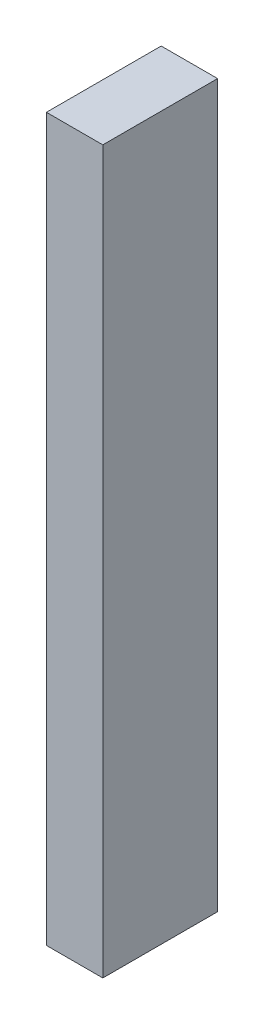
from build123d import *

# Parameters (mm, degrees)
SKETCH1_W           = 25.4
SKETCH1_H           = 50.8
BOSS_EXTRUDE1_DEPTH = 558.8
SKETCH2_R           = 6.35
BOSS_EXTRUDE2_DEPTH = 6.35
SKETCH3_W           = 50.8
SKETCH3_H           = 558.8
BOSS_EXTRUDE3_DEPTH = 18.288
SKETCH4_W           = 43.688
SKETCH4_H           = 558.8
BOSS_EXTRUDE4_DEPTH = 19.05
SKETCH5_W           = 43.688
SKETCH5_H           = 558.8
BOSS_EXTRUDE5_DEPTH = 19.05


with BuildPart() as part:
    # Sketch1 → Boss-Extrude1 (new body)
    with BuildSketch(Plane(origin=(0, 0, 0), x_dir=(1, 0, 0), z_dir=(0, 1, 0))):
        with Locations((12.7, 25.4)):
            Rectangle(SKETCH1_W, SKETCH1_H)
    extrude(amount=BOSS_EXTRUDE1_DEPTH)

    # Sketch2 → Boss-Extrude2 (add)
    with BuildSketch(Plane(origin=(0, 0, -50.8), x_dir=(-1, 0, 0), z_dir=(0, 0, -1))):
        with Locations((-12.7, 546.1)):
            Circle(SKETCH2_R)
    extrude(amount=BOSS_EXTRUDE2_DEPTH)

    # Sketch3 → Boss-Extrude3 (add)
    with BuildSketch(Plane.ZY):
        with Locations((-25.4, 279.4)):
            Rectangle(SKETCH3_W, SKETCH3_H)
    extrude(amount=BOSS_EXTRUDE3_DEPTH)

    # Sketch4 → Boss-Extrude4 (add)
    with BuildSketch(Plane(origin=(0, 0, -50.8), x_dir=(-1, 0, 0), z_dir=(0, 0, -1))):
        with Locations((-3.556, 279.4)):
            Rectangle(SKETCH4_W, SKETCH4_H)
    extrude(amount=BOSS_EXTRUDE4_DEPTH)

    # Sketch5 → Boss-Extrude5 (add)
    with BuildSketch(Plane.XY):
        with Locations((3.556, 279.4)):
            Rectangle(SKETCH5_W, SKETCH5_H)
    extrude(amount=BOSS_EXTRUDE5_DEPTH)


solid = part.part
